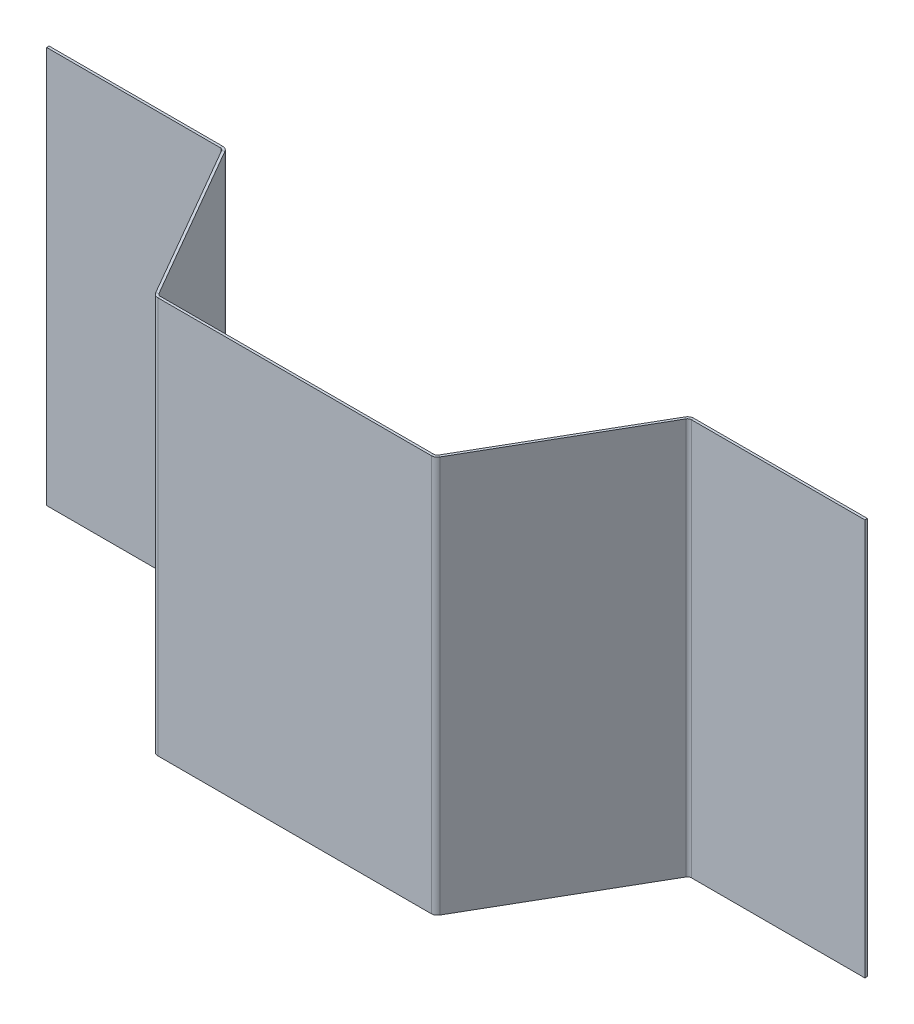
from build123d import *

# Parameters (mm, degrees)
T_LE_DE_BASE_PLI_E1_DEPTH = 160


# Sheet-metal steps are written as plain solids
with BuildPart() as part:
    # Esquisse1 → Tôle de base pliée1 (new body)
    with BuildSketch(Plane.XZ):
        with BuildLine():
            Line((165, -65), (94.97114317, -65))
            ThreePointArc((94.97114317, -65), (93.72114317, -64.665063509), (92.806079661, -63.75))
            Line((92.806079661, -63.75), (56.433012702, -0.75))
            ThreePointArc((56.433012702, -0.75), (55.883974596, -0.200961894), (55.133974596, 0))
            Line((55.133974596, 0), (-55.133974596, 0))
            ThreePointArc((-55.133974596, 0), (-55.883974596, -0.200961894), (-56.433012702, -0.75))
            Line((-56.433012702, -0.75), (-92.806079661, -63.75))
            ThreePointArc((-92.806079661, -63.75), (-93.72114317, -64.665063509), (-94.97114317, -65))
            Line((-94.97114317, -65), (-165, -65))
            Line((-165, -65), (-165, -64))
            Line((-165, -64), (-94.97114317, -64))
            ThreePointArc((-94.97114317, -64), (-94.22114317, -63.799038106), (-93.672105065, -63.25))
            Line((-93.672105065, -63.25), (-57.299038106, -0.25))
            ThreePointArc((-57.299038106, -0.25), (-56.383974596, 0.665063509), (-55.133974596, 1))
            Line((-55.133974596, 1), (55.133974596, 1))
            ThreePointArc((55.133974596, 1), (56.383974596, 0.665063509), (57.299038106, -0.25))
            Line((57.299038106, -0.25), (93.672105065, -63.25))
            ThreePointArc((93.672105065, -63.25), (94.22114317, -63.799038106), (94.97114317, -64))
            Line((94.97114317, -64), (165, -64))
            Line((165, -64), (165, -65))
        make_face()
    extrude(amount=T_LE_DE_BASE_PLI_E1_DEPTH)


solid = part.part
